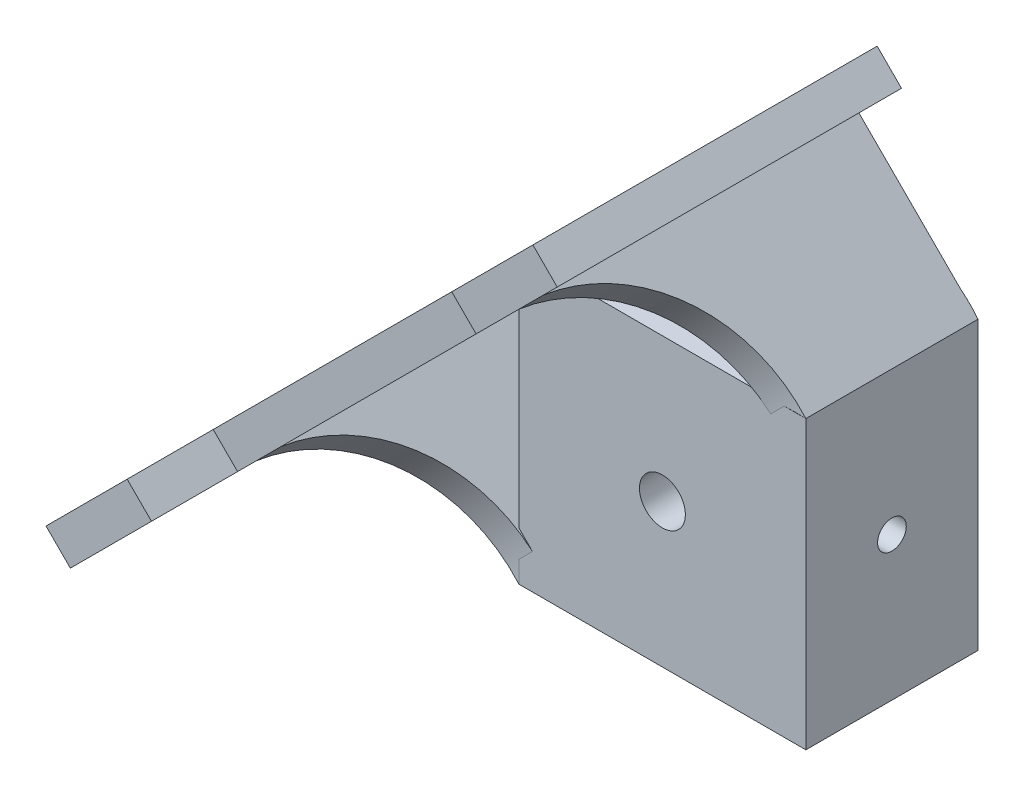
from build123d import *

# Parameters (mm, degrees)
SKETCH_1_W          = 25
SKETCH_1_H          = 25
EXTRUDE_1_DEPTH     = 10
SKETCH_2_W          = 12.5
SKETCH_2_H          = 12.5
CUT_EXTRUDE_1_DEPTH = 21.310096012
SKETCH_3_W          = 25
SKETCH_3_H          = 25
EXTRUDE_2_DEPTH     = 5
SKETCH_4_R          = 2
CUT_EXTRUDE_2_DEPTH = 24.184046239
SKETCH_5_W          = 15
SKETCH_5_H          = 40
EXTRUDE_3_DEPTH     = 3
SKETCH_9_W          = 30
SKETCH_9_H          = 10
EXTRUDE_7_DEPTH     = 3
SKETCH_11_R         = 1.5
CUT_EXTRUDE_3_DEPTH = 50.749371855
EXTRUDE_8_DEPTH     = 12.5
EXTRUDE_9_DEPTH     = 3
SKETCH_15_R         = 1.25
CUT_EXTRUDE_4_DEPTH = 10
EXTRUDE_START       = -3
EXTRUDE_10_DEPTH    = 3


# Read off the part's stored shape, not the designer's step: 凸台-拉伸10
with BuildPart() as part:
    # 草图1 → 凸台-拉伸1 (new body)
    with BuildSketch(Plane.XY):
        Rectangle(SKETCH_1_W, SKETCH_1_H)
    extrude(amount=EXTRUDE_1_DEPTH)

    # 草图2 → 切除-拉伸1 (cut, through all)
    with BuildSketch(Plane.XY.offset(10)):
        Rectangle(SKETCH_2_W, SKETCH_2_H)
    extrude(amount=-CUT_EXTRUDE_1_DEPTH, mode=Mode.SUBTRACT)

    # 草图3 → 凸台-拉伸2 (add)
    with BuildSketch(Plane.XY.offset(10)):
        Rectangle(SKETCH_3_W, SKETCH_3_H)
    extrude(amount=EXTRUDE_2_DEPTH)

    # 草图4 → 切除-拉伸2 (cut, through all)
    with BuildSketch(Plane.XY.offset(15)):
        Circle(SKETCH_4_R)
    extrude(amount=-CUT_EXTRUDE_2_DEPTH, mode=Mode.SUBTRACT)

    # 草图5 → 凸台-拉伸3 (add)
    with BuildSketch(Plane(origin=(-12.5, 12.5, 0), x_dir=(0, 0, -1), z_dir=(0.7071067811865477, -0.7071067811865474, 0))):
        with Locations((-20, 0)):
            Rectangle(SKETCH_5_W, SKETCH_5_H)
    extrude(amount=EXTRUDE_3_DEPTH)

    # 草图9 → 凸台-拉伸7 (add)
    with BuildSketch(Plane(origin=(-10.378679656, 10.378679656, 0), x_dir=(0, 0, -1), z_dir=(0.7071067811865477, -0.7071067811865474, 0))):
        with Locations((-20, 25)):
            Rectangle(SKETCH_9_W, SKETCH_9_H)
    extrude_7 = extrude(amount=-EXTRUDE_7_DEPTH)

    # 草图11 → 切除-拉伸3 (cut, through all)
    with BuildSketch(Plane(origin=(-12.5, 12.5, 0), x_dir=(0, 0, 1), z_dir=(-0.7071067811865477, 0.7071067811865474, 0))):
        with Locations(Location((11, 24, 0), (0, 0, 270))):
            Circle(SKETCH_11_R)
        with Locations(Location((29, 24, 0), (0, 0, 270))):
            Circle(SKETCH_11_R)
    cut_extrude_3 = extrude(amount=-CUT_EXTRUDE_3_DEPTH, mode=Mode.SUBTRACT)

    # 草图12 → 凸台-拉伸8 (add)
    with BuildSketch(Plane(origin=(0, 0, 12.5), x_dir=(-1, 0, 0), z_dir=(0, 0, -1))):
        Polygon((8.257359313, 12.5), (12.5, 8.257359313), (14.621320344, 10.378679656), (10.378679656, 14.621320344), align=None)
    extrude(amount=EXTRUDE_8_DEPTH)

    # 草图13 → 凸台-拉伸9 (add)
    with BuildSketch(Plane(origin=(12.5, 12.5, 0), x_dir=(0, 0, -1), z_dir=(-0.7071067811865474, -0.7071067811865477, 0))):
        with BuildLine():
            Line((-27.5, -14.67766953), (-12.5, -14.67766953))
            ThreePointArc((-12.5, -14.67766953), (-3.210155108, -9.92766953), (0, 0))
            Line((0, 0), (-15, 0))
            ThreePointArc((-15, 0), (-18.349852274, -9.808698696), (-27.5, -14.67766953))
        make_face()
    extrude_9 = extrude(amount=EXTRUDE_9_DEPTH)

    # 草图15 → 切除-拉伸4 (cut)
    with BuildSketch(Plane(origin=(12.5, 0, 0), x_dir=(0, 0, -1), z_dir=(1, 0, 0))):
        with Locations(Location((-7.5, 0, 0), (0, 0, 90))):
            Circle(SKETCH_15_R)
    cut_extrude_4 = extrude(amount=-CUT_EXTRUDE_4_DEPTH, mode=Mode.SUBTRACT)

    # 凸台-拉伸10 outline → 凸台-拉伸10 (add)
    with BuildSketch(Plane(origin=(12.5, 12.5, 0), x_dir=(0, 0, -1), z_dir=(0.7071067811865474, 0.7071067811865477, 0)).offset(EXTRUDE_START)):
        with BuildLine():
            ThreePointArc((-12.5, 14.67766953), (-3.949281056, 10.728388475), (0, 2.177669532))
            Line((0, 2.177669532), (0, 17.67766953))
            Line((0, 17.67766953), (-12.5, 17.67766953))
            Line((-12.5, 17.67766953), (-12.5, 14.67766953))
        make_face()
    extrude_10 = extrude(amount=EXTRUDE_10_DEPTH)

    # 镜向3: 凸台-拉伸7, 切除-拉伸3, 凸台-拉伸9, 切除-拉伸4, 凸台-拉伸10 across plane
    add(extrude_7.mirror(Plane(origin=(0, 0, 0), x_dir=(0, 0, 1), z_dir=(-0.7071067811865474, -0.7071067811865477, 0))))
    add(cut_extrude_3.mirror(Plane(origin=(0, 0, 0), x_dir=(0, 0, 1), z_dir=(-0.7071067811865474, -0.7071067811865477, 0))), mode=Mode.SUBTRACT)
    add(extrude_9.mirror(Plane(origin=(0, 0, 0), x_dir=(0, 0, 1), z_dir=(-0.7071067811865474, -0.7071067811865477, 0))))
    add(cut_extrude_4.mirror(Plane(origin=(0, 0, 0), x_dir=(0, 0, 1), z_dir=(-0.7071067811865474, -0.7071067811865477, 0))), mode=Mode.SUBTRACT)
    add(extrude_10.mirror(Plane(origin=(0, 0, 0), x_dir=(0, 0, 1), z_dir=(-0.7071067811865474, -0.7071067811865477, 0))))


solid = part.part
